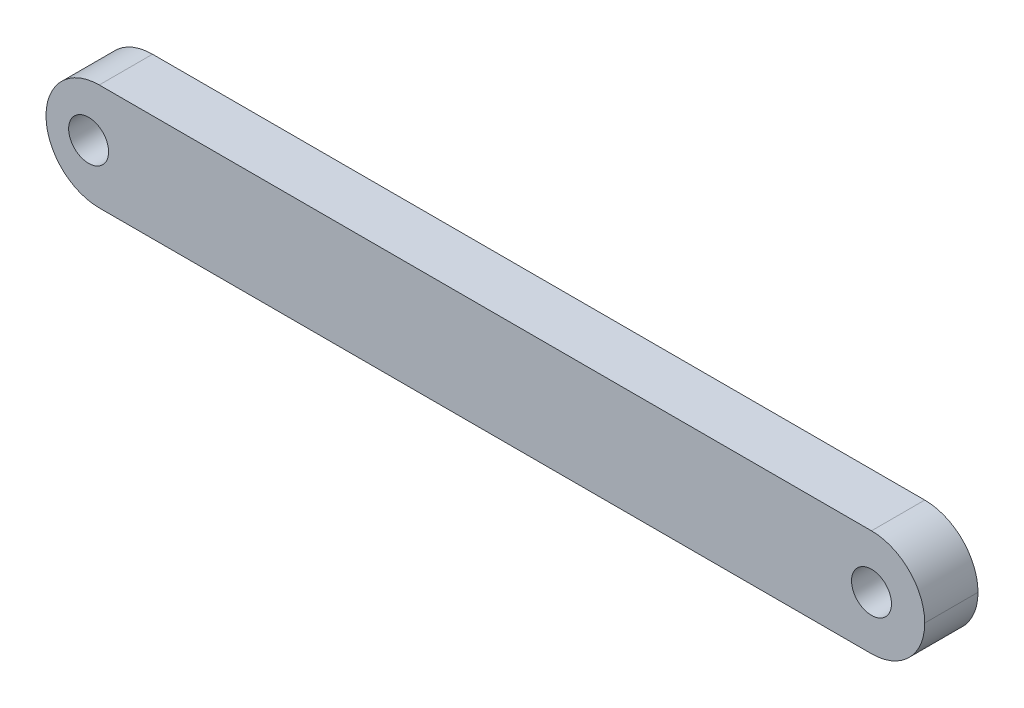
from build123d import *

# Parameters (mm, degrees)
SKETCH1_W           = 209.55
SKETCH1_H           = 12.7
BOSS_EXTRUDE1_DEPTH = 12.7
SKETCH2_R           = 4.7625
CUT_EXTRUDE1_DEPTH  = 107.303248422
FILLET1_R           = 12.7
SKETCH4_R           = 3.175
CUT_EXTRUDE3_DEPTH  = 12.7


with BuildPart() as part:
    # Sketch1 → Boss-Extrude1 (new, symmetric)
    with BuildSketch(Plane(origin=(0, 0, 0), x_dir=(1, 0, 0), z_dir=(0, 1, 0))):
        Rectangle(SKETCH1_W, SKETCH1_H)
    extrude(amount=BOSS_EXTRUDE1_DEPTH, both=True)

    # Sketch2 → Cut-Extrude1 (cut, through all)
    with BuildSketch(Plane.XY.offset(6.35)):
        with Locations((-94.615, 0)):
            Circle(SKETCH2_R)
        with Locations((92.075, 0)):
            Circle(SKETCH2_R)
    extrude(amount=-CUT_EXTRUDE1_DEPTH, mode=Mode.SUBTRACT)

    # Fillet1
    fillet1_edges = [part.edges().sort_by_distance(p)[0] for p in [
        (104.775, -12.7, 0),
        (104.775, 12.7, 0),
        (-104.775, -12.7, 0),
        (-104.775, 12.7, 0),
    ]]
    fillet(fillet1_edges, radius=FILLET1_R - 0.0001)  # a hair under: the kernel refuses the full size

    # Sketch4 → Cut-Extrude3 (cut)
    with BuildSketch(Plane.XZ.offset(12.7)):
        with Locations(Location((41.275, 0, 0), (0, 0, 270))):
            Circle(SKETCH4_R)
        with Locations(Location((66.675, 0, 0), (0, 0, 270))):
            Circle(SKETCH4_R)
    extrude(amount=-CUT_EXTRUDE3_DEPTH, mode=Mode.SUBTRACT)


solid = part.part
